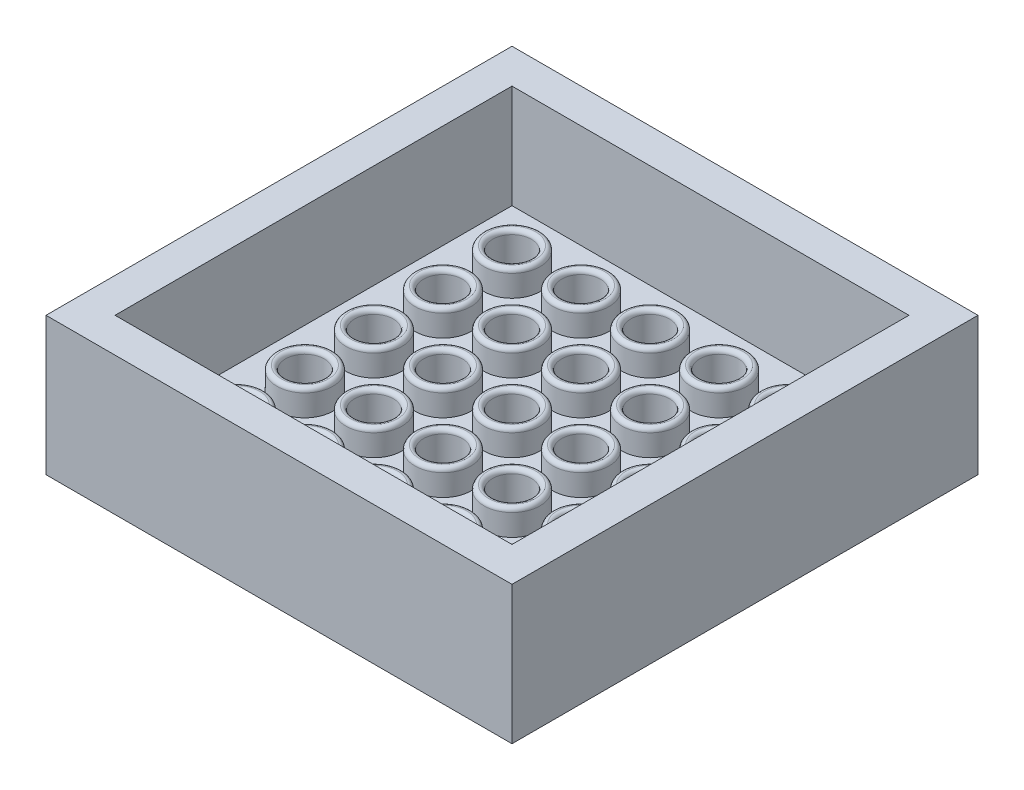
from build123d import *

# Parameters (mm, degrees)
SKETCH1_W              = 27
SKETCH1_H              = 27
SKETCH1_W_2            = 23
SKETCH1_H_2            = 23
BOSS_EXTRUDE1_DEPTH    = 2
SKETCH2_W              = 27
SKETCH2_H              = 27
BOSS_EXTRUDE2_DEPTH    = 2
SKETCH3_W              = 27
SKETCH3_H              = 27
SKETCH3_W_2            = 23
SKETCH3_H_2            = 23
BOSS_EXTRUDE3_DEPTH    = 3
SKETCH6_R              = 1.625
BOSS_EXTRUDE5_DEPTH    = 1.5
CUT_EXTRUDE2_REACH     = 22.168
SKETCH7_R              = 1.125
FILLET1_R              = 0.25
LPATTERN3_COUNT        = 5
LPATTERN3_PITCH        = 4
LPATTERN3_COUNT_DIR2   = 5
LPATTERN3_PITCH_DIR2   = 4
FILLET1_OF_LPATTERN3_R = 0.25
SKETCH11_R             = 0.75
BOSS_EXTRUDE8_DEPTH    = 3
LPATTERN2_COUNT        = 6
LPATTERN2_PITCH        = 4
LPATTERN2_COUNT_DIR2   = 6
LPATTERN2_PITCH_DIR2   = 4
SKETCH14_R             = 2.969848481
BOSS_EXTRUDE10_DEPTH   = 0.5
SKETCH8_W              = 27
SKETCH8_H              = 27
BOSS_EXTRUDE6_DEPTH    = 2
SKETCH9_R              = 4.25
CUT_EXTRUDE3_DEPTH     = 3
SKETCH10_W             = 27
SKETCH10_H             = 27
SKETCH10_W_2           = 23
SKETCH10_H_2           = 23
BOSS_EXTRUDE7_DEPTH    = 4
SKETCH15_R             = 0.75
BOSS_EXTRUDE11_DEPTH   = 3
SKETCH17_W             = 27
SKETCH17_H             = 27
CUT_EXTRUDE4_DEPTH     = 5


with BuildPart() as part:
    # Sketch1 → Boss-Extrude1 (new body)
    with BuildSketch(Plane(origin=(0, 0, 0), x_dir=(1, 0, 0), z_dir=(0, 1, 0))):
        Rectangle(SKETCH1_W, SKETCH1_H)
        Rectangle(SKETCH1_W_2, SKETCH1_H_2, mode=Mode.SUBTRACT)
    extrude(amount=BOSS_EXTRUDE1_DEPTH)

    # Sketch2 → Boss-Extrude2 (add)
    with BuildSketch(Plane.XZ):
        Rectangle(SKETCH2_W, SKETCH2_H)
    extrude(amount=BOSS_EXTRUDE2_DEPTH)

    # Sketch3 → Boss-Extrude3 (add)
    with BuildSketch(Plane.XZ.offset(2)):
        Rectangle(SKETCH3_W, SKETCH3_H)
        Rectangle(SKETCH3_W_2, SKETCH3_H_2, mode=Mode.SUBTRACT)
    extrude(amount=BOSS_EXTRUDE3_DEPTH)

    # Sketch6 → Boss-Extrude5 (add)
    with BuildSketch(Plane(origin=(0, 0, 0), x_dir=(1, 0, 0), z_dir=(0, 1, 0))):
        with Locations(Location((8, 8, 0), (0, 0, 90))):
            Circle(SKETCH6_R)
    boss_extrude5 = extrude(amount=BOSS_EXTRUDE5_DEPTH)

    # Sketch7 → Cut-Extrude2 (cut, up to next)
    with BuildSketch(Plane(origin=(0, 1.5, 0), x_dir=(1, 0, 0), z_dir=(0, 1, 0)), mode=Mode.PRIVATE) as cut_extrude2_sk1:
        with Locations(Location((8, 8, 0), (0, 0, 270))):
            Circle(SKETCH7_R)
    cut_extrude2_tool1 = extrude(cut_extrude2_sk1.sketch, amount=-CUT_EXTRUDE2_REACH, mode=Mode.PRIVATE) & part.part
    cut_extrude2 = cut_extrude2_tool1.solids().sort_by_distance((8, 1.5, -8))[0]
    add(cut_extrude2, mode=Mode.SUBTRACT)

    # Fillet1
    fillet1_edges = [part.edges().sort_by_distance(p)[0] for p in [
        (8, 1.5, -6.375),
        (8, 1.5, -9.125),
    ]]
    fillet(fillet1_edges, radius=FILLET1_R - 0.0001)  # a hair under: the kernel refuses the full size

    # LPattern3: Boss-Extrude5, Cut-Extrude2 5 × 5
    with Locations(*[(-j * LPATTERN3_PITCH_DIR2, 0, i * LPATTERN3_PITCH) for i in range(LPATTERN3_COUNT) for j in range(LPATTERN3_COUNT_DIR2) if (i, j) != (0, 0)]):
        add(boss_extrude5)
        add(cut_extrude2, mode=Mode.SUBTRACT)

    # Fillet1 of LPattern3
    fillet1_of_lpattern3_edges = [part.edges().sort_by_distance(p)[0] for p in [
        (4, 1.5, -6.375),
        (4, 1.5, -9.125),
        (0, 1.5, -6.375),
        (0, 1.5, -9.125),
        (-4, 1.5, -6.375),
        (-4, 1.5, -9.125),
        (-8, 1.5, -6.375),
        (-8, 1.5, -9.125),
        (8, 1.5, -2.375),
        (8, 1.5, -5.125),
        (4, 1.5, -2.375),
        (4, 1.5, -5.125),
        (0, 1.5, -2.375),
        (0, 1.5, -5.125),
        (-4, 1.5, -2.375),
        (-4, 1.5, -5.125),
        (-8, 1.5, -2.375),
        (-8, 1.5, -5.125),
        (8, 1.5, 1.625),
        (8, 1.5, -1.125),
        (4, 1.5, 1.625),
        (4, 1.5, -1.125),
        (0, 1.5, 1.625),
        (0, 1.5, -1.125),
        (-4, 1.5, 1.625),
        (-4, 1.5, -1.125),
        (-8, 1.5, 1.625),
        (-8, 1.5, -1.125),
        (8, 1.5, 5.625),
        (8, 1.5, 2.875),
        (4, 1.5, 5.625),
        (4, 1.5, 2.875),
        (0, 1.5, 5.625),
        (0, 1.5, 2.875),
        (-4, 1.5, 5.625),
        (-4, 1.5, 2.875),
        (-8, 1.5, 5.625),
        (-8, 1.5, 2.875),
        (8, 1.5, 9.625),
        (8, 1.5, 6.875),
        (4, 1.5, 9.625),
        (4, 1.5, 6.875),
        (0, 1.5, 9.625),
        (0, 1.5, 6.875),
        (-4, 1.5, 9.625),
        (-4, 1.5, 6.875),
        (-8, 1.5, 9.625),
        (-8, 1.5, 6.875),
    ]]
    fillet(fillet1_of_lpattern3_edges, radius=FILLET1_OF_LPATTERN3_R - 0.0001)  # a hair under: the kernel refuses the full size

    # Sketch11 → Boss-Extrude8 (add)
    with BuildSketch(Plane.XZ.offset(2)):
        with Locations(Location((-9.9, 9.9, 0), (0, 0, 90))):
            Circle(SKETCH11_R)
    boss_extrude8 = extrude(amount=BOSS_EXTRUDE8_DEPTH)

    # LPattern2: Boss-Extrude8 6 × 6
    with Locations(*[(i * LPATTERN2_PITCH, 0, -j * LPATTERN2_PITCH_DIR2) for i in range(LPATTERN2_COUNT) for j in range(LPATTERN2_COUNT_DIR2) if (i, j) != (0, 0)]):
        add(boss_extrude8)

    # Sketch14 → Boss-Extrude10 (add)
    with BuildSketch(Plane(origin=(0, -3.5, 0), x_dir=(-1, 0, 0), z_dir=(0, -1, 0))):
        Circle(SKETCH14_R)
    extrude(amount=-BOSS_EXTRUDE10_DEPTH)

    # Sketch8 → Boss-Extrude6 (add)
    with BuildSketch(Plane.XZ.offset(5)):
        Rectangle(SKETCH8_W, SKETCH8_H)
    extrude(amount=BOSS_EXTRUDE6_DEPTH)

    # Sketch9 → Cut-Extrude3 (cut)
    with BuildSketch(Plane.XZ.offset(7)):
        with Locations(Location((0, 0, 0), (0, 0, 270))):
            Circle(SKETCH9_R)
    extrude(amount=-CUT_EXTRUDE3_DEPTH, mode=Mode.SUBTRACT)

    # Sketch10 → Boss-Extrude7 (add)
    with BuildSketch(Plane(origin=(0, 2, 0), x_dir=(1, 0, 0), z_dir=(0, 1, 0))):
        Rectangle(SKETCH10_W, SKETCH10_H)
        Rectangle(SKETCH10_W_2, SKETCH10_H_2, mode=Mode.SUBTRACT)
    extrude(amount=BOSS_EXTRUDE7_DEPTH)

    # Sketch15 → Boss-Extrude11 (add)
    with BuildSketch(Plane.XZ.offset(4)):
        with Locations(Location((2.1, 1.9, 0), (0, 0, 90))):
            Circle(SKETCH15_R)
        with Locations(Location((-1.9, -2.1, 0), (0, 0, 90))):
            Circle(SKETCH15_R)
        with Locations(Location((2.1, -2.1, 0), (0, 0, 90))):
            Circle(SKETCH15_R)
        with Locations(Location((-1.9, 1.9, 0), (0, 0, 90))):
            Circle(SKETCH15_R)
    extrude(amount=BOSS_EXTRUDE11_DEPTH)

    # Sketch17 → Cut-Extrude4 (cut)
    with BuildSketch(Plane.XZ.offset(7)):
        Rectangle(SKETCH17_W, SKETCH17_H)
    extrude(amount=-CUT_EXTRUDE4_DEPTH, mode=Mode.SUBTRACT)


solid = part.part
